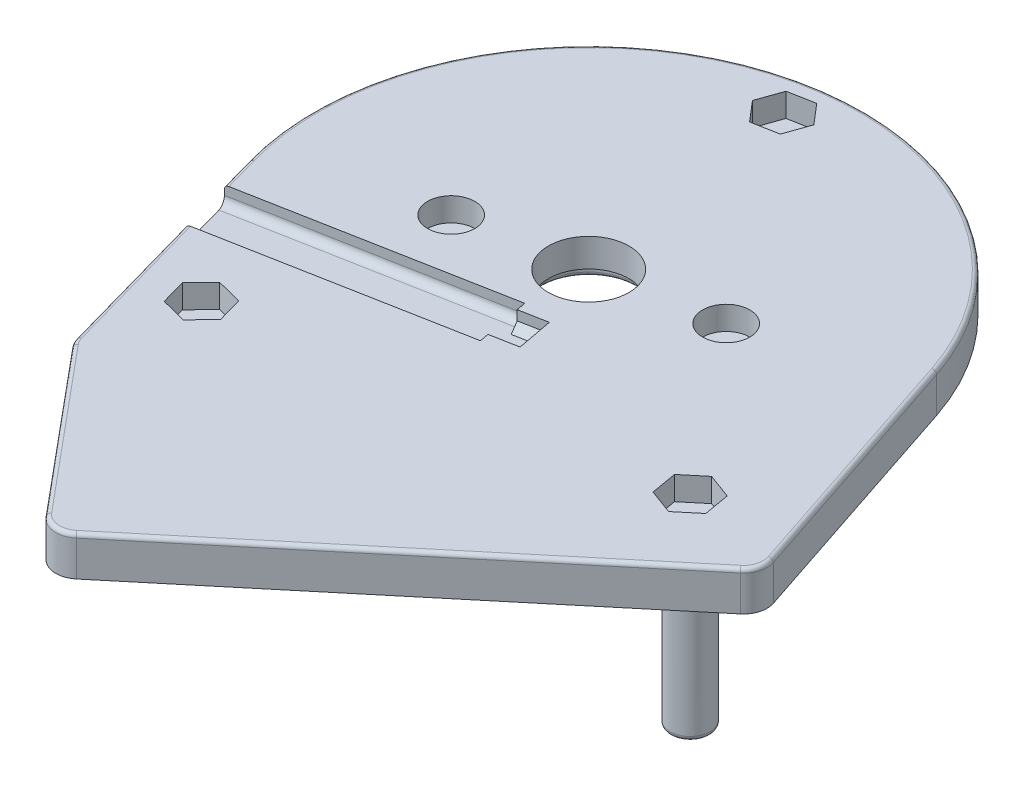
from build123d import *

# Parameters (mm, degrees)
SKETCH1_R           = 3
SKETCH1_R_2         = 5.925
SKETCH1_R_3         = 1.6
SKETCH1_R_4         = 5.125
SKETCH1_R_5         = 2.55
SKETCH1_R_6         = 1.75
BOSS_EXTRUDE7_DEPTH = 5
CUT_EXTRUDE5_START  = 2
SKETCH1_10_R        = 3
SKETCH1_10_R_2      = 1.6
SKETCH1_10_R_3      = 2.55
SKETCH1_10_R_4      = 1.75
CUT_EXTRUDE5_DEPTH  = 3
BOSS_EXTRUDE8_START = 1.8
SKETCH1_11_R        = 1.6
BOSS_EXTRUDE8_DEPTH = 0.2
SKETCH1_12_R        = 5.925
SKETCH1_12_R_2      = 5.125
CUT_EXTRUDE6_DEPTH  = 1.4
SKETCH1_13_R        = 2.55
SKETCH1_13_R_2      = 1.75
BOSS_EXTRUDE9_DEPTH = 20.5
FILLET2_R           = 0.6
FILLET3_R           = 0.5
CUT_EXTRUDE8_DEPTH  = 1.75
CUT_EXTRUDE11_START = -1.75
CUT_EXTRUDE11_DEPTH = 81.470079501
FILLET4_R           = 1
CUT_EXTRUDE12_START = -0.2
CUT_EXTRUDE12_DEPTH = 0.8
FILLET5_R           = 0.5
FILLET6_SIZE        = 1.5
FILLET6_SIZE_2      = 3


with BuildPart() as part:
    # Sketch1 → Boss-Extrude7 (new body)
    # profile 1 of 13: a face of its own
    with BuildSketch(Plane(origin=(0, 26, 0), x_dir=(1, 0, 0), z_dir=(0, 1, 0))):
        with BuildLine():
            Line((-24.557589494, -41.040910968), (-7.688083041, -61.295294711))
            ThreePointArc((-7.688083041, -61.295294711), (-5.655310978, -62.362963047), (-3.462968546, -61.680531657))
            Line((-3.462968546, -61.680531657), (42.605822592, -23.310676556))
            ThreePointArc((42.605822592, -23.310676556), (43.570730463, -21.828701805), (43.533219398, -20.060683343))
            Line((43.533219398, -20.060683343), (33.218915104, 11.022870738))
            ThreePointArc((33.218915104, 11.022870738), (-10.245273875, 33.466914456), (-33.696714348, -9.462105586))
            Line((-33.696714348, -9.462105586), (-25.140703574, -39.932009816))
            ThreePointArc((-25.140703574, -39.932009816), (-24.907679574, -40.517239907), (-24.557589494, -41.040910968))
        make_face()
        with Locations((-14.717565499, -2.764758718)):
            Circle(SKETCH1_R, mode=Mode.SUBTRACT)
        Circle(SKETCH1_R_2, mode=Mode.SUBTRACT)
        with Locations((14.717565499, 2.764758718)):
            Circle(SKETCH1_R, mode=Mode.SUBTRACT)
        Polygon((-20.200894533, -31.346594202), (-17.861525421, -28.950621437), (-18.766814147, -25.726681974), (-22.011471984, -24.898715278), (-24.350841096, -27.294688043), (-23.44555237, -30.518627505), align=None, mode=Mode.SUBTRACT)
        Polygon((28.622795709, -20.44054474), (31.76526722, -21.597353341), (34.338328611, -19.454297482), (33.768918491, -16.154433023), (30.62644698, -14.997624422), (28.05338559, -17.140680281), align=None, mode=Mode.SUBTRACT)
        Polygon((-3.765850495, 32.760363126), (-7.056915893, 32.142122171), (-8.167036219, 28.982855453), (-5.986091147, 26.44182969), (-2.695025749, 27.060070645), (-1.584905423, 30.219337363), align=None, mode=Mode.SUBTRACT)
    # profile 2 of 13: a face of its own
    with BuildSketch(Plane(origin=(0, 26, 0), x_dir=(1, 0, 0), z_dir=(0, 1, 0))):
        with Locations((-14.717565499, -2.764758718)):
            Circle(SKETCH1_R)
        with Locations(Location((-14.717565499, -2.764758718, 0), (0, 0, 270))):
            Circle(SKETCH1_R_3, mode=Mode.SUBTRACT)
    # profile 3 of 13: a face of its own
    with BuildSketch(Plane(origin=(0, 26, 0), x_dir=(1, 0, 0), z_dir=(0, 1, 0))):
        with Locations((14.717565499, 2.764758718)):
            Circle(SKETCH1_R)
        with Locations(Location((14.717565499, 2.764758718, 0), (0, 0, 270))):
            Circle(SKETCH1_R_3, mode=Mode.SUBTRACT)
    # profile 4 of 13: a face of its own
    with BuildSketch(Plane(origin=(0, 26, 0), x_dir=(1, 0, 0), z_dir=(0, 1, 0))):
        Circle(SKETCH1_R_2)
        with Locations(Location((0, 0, 0), (0, 0, 270))):
            Circle(SKETCH1_R_4, mode=Mode.SUBTRACT)
    # profile 5 of 13: a face of its own
    with BuildSketch(Plane(origin=(0, 26, 0), x_dir=(1, 0, 0), z_dir=(0, 1, 0))):
        Polygon((-23.44555237, -30.518627505), (-20.200894533, -31.346594202), (-17.861525421, -28.950621437), (-18.766814147, -25.726681974), (-22.011471984, -24.898715278), (-24.350841096, -27.294688043), align=None)
        with Locations((-21.106183258, -28.12265474)):
            Circle(SKETCH1_R_5, mode=Mode.SUBTRACT)
    # profile 6 of 13: a face of its own
    with BuildSketch(Plane(origin=(0, 26, 0), x_dir=(1, 0, 0), z_dir=(0, 1, 0))):
        with Locations((-21.106183258, -28.12265474)):
            Circle(SKETCH1_R_5)
        with Locations((-21.106183258, -28.12265474)):
            Circle(SKETCH1_R_6, mode=Mode.SUBTRACT)
    # profile 7 of 13: a face of its own
    with BuildSketch(Plane(origin=(0, 26, 0), x_dir=(1, 0, 0), z_dir=(0, 1, 0))):
        with Locations((-21.106183258, -28.12265474)):
            Circle(SKETCH1_R_6)
        with Locations(Location((-21.106183258, -28.12265474, 0), (0, 0, 270))):
            Circle(SKETCH1_R_3, mode=Mode.SUBTRACT)
    # profile 8 of 13: a face of its own
    with BuildSketch(Plane(origin=(0, 26, 0), x_dir=(1, 0, 0), z_dir=(0, 1, 0))):
        Polygon((28.05338559, -17.140680281), (28.622795709, -20.44054474), (31.76526722, -21.597353341), (34.338328611, -19.454297482), (33.768918491, -16.154433023), (30.62644698, -14.997624422), align=None)
        with Locations((31.1958571, -18.297488882)):
            Circle(SKETCH1_R_5, mode=Mode.SUBTRACT)
    # profile 9 of 13: a face of its own
    with BuildSketch(Plane(origin=(0, 26, 0), x_dir=(1, 0, 0), z_dir=(0, 1, 0))):
        with Locations((31.1958571, -18.297488882)):
            Circle(SKETCH1_R_5)
        with Locations((31.1958571, -18.297488882)):
            Circle(SKETCH1_R_6, mode=Mode.SUBTRACT)
    # profile 10 of 13: a face of its own
    with BuildSketch(Plane(origin=(0, 26, 0), x_dir=(1, 0, 0), z_dir=(0, 1, 0))):
        with Locations((31.1958571, -18.297488882)):
            Circle(SKETCH1_R_6)
        with Locations(Location((31.1958571, -18.297488882, 0), (0, 0, 270))):
            Circle(SKETCH1_R_3, mode=Mode.SUBTRACT)
    # profile 11 of 13: a face of its own
    with BuildSketch(Plane(origin=(0, 26, 0), x_dir=(1, 0, 0), z_dir=(0, 1, 0))):
        Polygon((-1.584905423, 30.219337363), (-3.765850495, 32.760363126), (-7.056915893, 32.142122171), (-8.167036219, 28.982855453), (-5.986091147, 26.44182969), (-2.695025749, 27.060070645), align=None)
        with Locations((-4.875970821, 29.601096408)):
            Circle(SKETCH1_R_5, mode=Mode.SUBTRACT)
    # profile 12 of 13: a face of its own
    with BuildSketch(Plane(origin=(0, 26, 0), x_dir=(1, 0, 0), z_dir=(0, 1, 0))):
        with Locations((-4.875970821, 29.601096408)):
            Circle(SKETCH1_R_5)
        with Locations((-4.875970821, 29.601096408)):
            Circle(SKETCH1_R_6, mode=Mode.SUBTRACT)
    # profile 13 of 13: a face of its own
    with BuildSketch(Plane(origin=(0, 26, 0), x_dir=(1, 0, 0), z_dir=(0, 1, 0))):
        with Locations((-4.875970821, 29.601096408)):
            Circle(SKETCH1_R_6)
        with Locations(Location((-4.875970821, 29.601096408, 0), (0, 0, 270))):
            Circle(SKETCH1_R_3, mode=Mode.SUBTRACT)
    extrude(amount=BOSS_EXTRUDE7_DEPTH)

    # Sketch1<10> → Cut-Extrude5 (cut)
    # profile 1 of 11: a face of its own
    with BuildSketch(Plane(origin=(0, 26, 0), x_dir=(1, 0, 0), z_dir=(0, 1, 0)).offset(CUT_EXTRUDE5_START)):
        with Locations(Location((-14.717565499, -2.764758718, 0), (0, 0, 270))):
            Circle(SKETCH1_10_R)
        with Locations(Location((-14.717565499, -2.764758718, 0), (0, 0, 270))):
            Circle(SKETCH1_10_R_2, mode=Mode.SUBTRACT)
    # profile 2 of 11: a face of its own
    with BuildSketch(Plane(origin=(0, 26, 0), x_dir=(1, 0, 0), z_dir=(0, 1, 0)).offset(CUT_EXTRUDE5_START)):
        with Locations(Location((14.717565499, 2.764758718, 0), (0, 0, 270))):
            Circle(SKETCH1_10_R)
        with Locations(Location((14.717565499, 2.764758718, 0), (0, 0, 270))):
            Circle(SKETCH1_10_R_2, mode=Mode.SUBTRACT)
    # profile 3 of 11: a face of its own
    with BuildSketch(Plane(origin=(0, 26, 0), x_dir=(1, 0, 0), z_dir=(0, 1, 0)).offset(CUT_EXTRUDE5_START)):
        Polygon((28.05338559, -17.140680281), (28.622795709, -20.44054474), (31.76526722, -21.597353341), (34.338328611, -19.454297482), (33.768918491, -16.154433023), (30.62644698, -14.997624422), align=None)
        with Locations((31.1958571, -18.297488882)):
            Circle(SKETCH1_10_R_3, mode=Mode.SUBTRACT)
    # profile 4 of 11: a face of its own
    with BuildSketch(Plane(origin=(0, 26, 0), x_dir=(1, 0, 0), z_dir=(0, 1, 0)).offset(CUT_EXTRUDE5_START)):
        with Locations((31.1958571, -18.297488882)):
            Circle(SKETCH1_10_R_3)
        with Locations((31.1958571, -18.297488882)):
            Circle(SKETCH1_10_R_4, mode=Mode.SUBTRACT)
    # profile 5 of 11: a face of its own
    with BuildSketch(Plane(origin=(0, 26, 0), x_dir=(1, 0, 0), z_dir=(0, 1, 0)).offset(CUT_EXTRUDE5_START)):
        with Locations((31.1958571, -18.297488882)):
            Circle(SKETCH1_10_R_4)
        with Locations(Location((31.1958571, -18.297488882, 0), (0, 0, 270))):
            Circle(SKETCH1_10_R_2, mode=Mode.SUBTRACT)
    # profile 6 of 11: a face of its own
    with BuildSketch(Plane(origin=(0, 26, 0), x_dir=(1, 0, 0), z_dir=(0, 1, 0)).offset(CUT_EXTRUDE5_START)):
        Polygon((-23.44555237, -30.518627505), (-20.200894533, -31.346594202), (-17.861525421, -28.950621437), (-18.766814147, -25.726681974), (-22.011471984, -24.898715278), (-24.350841096, -27.294688043), align=None)
        with Locations((-21.106183258, -28.12265474)):
            Circle(SKETCH1_10_R_3, mode=Mode.SUBTRACT)
    # profile 7 of 11: a face of its own
    with BuildSketch(Plane(origin=(0, 26, 0), x_dir=(1, 0, 0), z_dir=(0, 1, 0)).offset(CUT_EXTRUDE5_START)):
        with Locations((-21.106183258, -28.12265474)):
            Circle(SKETCH1_10_R_3)
        with Locations((-21.106183258, -28.12265474)):
            Circle(SKETCH1_10_R_4, mode=Mode.SUBTRACT)
    # profile 8 of 11: a face of its own
    with BuildSketch(Plane(origin=(0, 26, 0), x_dir=(1, 0, 0), z_dir=(0, 1, 0)).offset(CUT_EXTRUDE5_START)):
        with Locations((-21.106183258, -28.12265474)):
            Circle(SKETCH1_10_R_4)
        with Locations(Location((-21.106183258, -28.12265474, 0), (0, 0, 270))):
            Circle(SKETCH1_10_R_2, mode=Mode.SUBTRACT)
    # profile 9 of 11: a face of its own
    with BuildSketch(Plane(origin=(0, 26, 0), x_dir=(1, 0, 0), z_dir=(0, 1, 0)).offset(CUT_EXTRUDE5_START)):
        Polygon((-1.584905423, 30.219337363), (-3.765850495, 32.760363126), (-7.056915893, 32.142122171), (-8.167036219, 28.982855453), (-5.986091147, 26.44182969), (-2.695025749, 27.060070645), align=None)
        with Locations((-4.875970821, 29.601096408)):
            Circle(SKETCH1_10_R_3, mode=Mode.SUBTRACT)
    # profile 10 of 11: a face of its own
    with BuildSketch(Plane(origin=(0, 26, 0), x_dir=(1, 0, 0), z_dir=(0, 1, 0)).offset(CUT_EXTRUDE5_START)):
        with Locations((-4.875970821, 29.601096408)):
            Circle(SKETCH1_10_R_3)
        with Locations((-4.875970821, 29.601096408)):
            Circle(SKETCH1_10_R_4, mode=Mode.SUBTRACT)
    # profile 11 of 11: a face of its own
    with BuildSketch(Plane(origin=(0, 26, 0), x_dir=(1, 0, 0), z_dir=(0, 1, 0)).offset(CUT_EXTRUDE5_START)):
        with Locations((-4.875970821, 29.601096408)):
            Circle(SKETCH1_10_R_4)
        with Locations(Location((-4.875970821, 29.601096408, 0), (0, 0, 270))):
            Circle(SKETCH1_10_R_2, mode=Mode.SUBTRACT)
    extrude(amount=CUT_EXTRUDE5_DEPTH, mode=Mode.SUBTRACT)

    # Sketch1<11> → Boss-Extrude8 (add)
    with BuildSketch(Plane(origin=(0, 26, 0), x_dir=(1, 0, 0), z_dir=(0, 1, 0)).offset(BOSS_EXTRUDE8_START)):
        with Locations(Location((31.1958571, -18.297488882, 0), (0, 0, 270))):
            Circle(SKETCH1_11_R)
        with Locations(Location((-21.106183258, -28.12265474, 0), (0, 0, 270))):
            Circle(SKETCH1_11_R)
        with Locations(Location((-14.717565499, -2.764758718, 0), (0, 0, 270))):
            Circle(SKETCH1_11_R)
        with Locations(Location((14.717565499, 2.764758718, 0), (0, 0, 270))):
            Circle(SKETCH1_11_R)
        with Locations(Location((-4.875970821, 29.601096408, 0), (0, 0, 270))):
            Circle(SKETCH1_11_R)
    extrude(amount=BOSS_EXTRUDE8_DEPTH)

    # Sketch1<12> → Cut-Extrude6 (cut)
    with BuildSketch(Plane(origin=(0, 26, 0), x_dir=(1, 0, 0), z_dir=(0, 1, 0))):
        with Locations(Location((0, 0, 0), (0, 0, 270))):
            Circle(SKETCH1_12_R)
        with Locations(Location((0, 0, 0), (0, 0, 270))):
            Circle(SKETCH1_12_R_2, mode=Mode.SUBTRACT)
    extrude(amount=CUT_EXTRUDE6_DEPTH, mode=Mode.SUBTRACT)

    # Sketch1<13> → Boss-Extrude9 (add)
    # profile 1 of 3: a face of its own
    with BuildSketch(Plane(origin=(0, 26, 0), x_dir=(1, 0, 0), z_dir=(0, 1, 0))):
        with Locations(Location((31.1958571, -18.297488882, 0), (0, 0, 270))):
            Circle(SKETCH1_13_R)
        with Locations(Location((31.1958571, -18.297488882, 0), (0, 0, 270))):
            Circle(SKETCH1_13_R_2, mode=Mode.SUBTRACT)
    # profile 2 of 3: a face of its own
    with BuildSketch(Plane(origin=(0, 26, 0), x_dir=(1, 0, 0), z_dir=(0, 1, 0))):
        with Locations(Location((-21.106183258, -28.12265474, 0), (0, 0, 270))):
            Circle(SKETCH1_13_R)
        with Locations(Location((-21.106183258, -28.12265474, 0), (0, 0, 270))):
            Circle(SKETCH1_13_R_2, mode=Mode.SUBTRACT)
    # profile 3 of 3: a face of its own
    with BuildSketch(Plane(origin=(0, 26, 0), x_dir=(1, 0, 0), z_dir=(0, 1, 0))):
        with Locations(Location((-4.875970821, 29.601096408, 0), (0, 0, 270))):
            Circle(SKETCH1_13_R)
        with Locations(Location((-4.875970821, 29.601096408, 0), (0, 0, 270))):
            Circle(SKETCH1_13_R_2, mode=Mode.SUBTRACT)
    extrude(amount=-BOSS_EXTRUDE9_DEPTH)

    # Fillet2
    fillet2_edges = [part.edges().sort_by_distance(p)[0] for p in [
        (31.1958571, 5.5, 15.747488882),
        (-21.106183258, 5.5, 25.57265474),
        (-4.875970821, 5.5, -31.351096408),
    ]]
    fillet(fillet2_edges, radius=FILLET2_R)

    # Fillet3
    fillet3_edges = [part.edges().sort_by_distance(p)[0] for p in [
        (0, 26, -5.925),
    ]]
    fillet(fillet3_edges, radius=FILLET3_R)

    # Sketch4 → Cut-Extrude8 (cut, symmetric)
    # profile 1 of 2: a face of its own
    with BuildSketch(Plane(origin=(0, 0, 0), x_dir=(-0.18462495614104718, 0, -0.9828090483760904), z_dir=(0.9828090483760904, 0, -0.18462495614104718))):
        Polygon((-13.485, 29.763447588), (-13.485, 31), (-8.825, 31), (-8.825, 29.763447588), (-9.783011998, 28.83), (-12.526988002, 28.83), align=None)
        Polygon((-9.905, 29.13), (-9.125, 29.89), (-9.125, 30.7), (-13.185, 30.7), (-13.185, 29.89), (-12.405, 29.13), align=None, mode=Mode.SUBTRACT)
    # profile 2 of 2: a face of its own
    with BuildSketch(Plane(origin=(0, 0, 0), x_dir=(-0.18462495614104718, 0, -0.9828090483760904), z_dir=(0.9828090483760904, 0, -0.18462495614104718))):
        Polygon((-12.405, 29.13), (-9.905, 29.13), (-9.125, 29.89), (-9.125, 30.7), (-13.185, 30.7), (-13.185, 29.89), align=None)
    extrude(amount=CUT_EXTRUDE8_DEPTH, both=True, mode=Mode.SUBTRACT)

    # Sketch4<5> → Cut-Extrude11 (cut, through all)
    # profile 1 of 4: a face of its own
    with BuildSketch(Plane(origin=(0, 0, 0), x_dir=(-0.18462495614104718, 0, -0.9828090483760904), z_dir=(0.9828090483760904, 0, -0.18462495614104718)).offset(CUT_EXTRUDE11_START)):
        Polygon((-13.485, 29.763447588), (-13.485, 31), (-8.825, 31), (-8.825, 29.763447588), (-9.783011998, 28.83), (-12.526988002, 28.83), align=None)
        Polygon((-9.905, 29.13), (-9.125, 29.89), (-9.125, 30.7), (-13.185, 30.7), (-13.185, 29.89), (-12.405, 29.13), align=None, mode=Mode.SUBTRACT)
    # profile 2 of 4: a face of its own
    with BuildSketch(Plane(origin=(0, 0, 0), x_dir=(-0.18462495614104718, 0, -0.9828090483760904), z_dir=(0.9828090483760904, 0, -0.18462495614104718)).offset(CUT_EXTRUDE11_START)):
        Polygon((-12.405, 29.13), (-9.905, 29.13), (-9.125, 29.89), (-9.125, 30.7), (-13.185, 30.7), (-13.185, 29.89), align=None)
    # profile 3 of 4: a face of its own
    with BuildSketch(Plane(origin=(0, 0, 0), x_dir=(-0.18462495614104718, 0, -0.9828090483760904), z_dir=(0.9828090483760904, 0, -0.18462495614104718)).offset(CUT_EXTRUDE11_START)):
        Polygon((-13.485, 29.763447588), (-13.485, 31), (-14.685, 31), (-14.685, 28.83), (-12.526988002, 28.83), align=None)
    # profile 4 of 4: a face of its own
    with BuildSketch(Plane(origin=(0, 0, 0), x_dir=(-0.18462495614104718, 0, -0.9828090483760904), z_dir=(0.9828090483760904, 0, -0.18462495614104718)).offset(CUT_EXTRUDE11_START)):
        Polygon((-7.625, 31), (-8.825, 31), (-8.825, 29.763447588), (-9.783011998, 28.83), (-7.625, 28.83), align=None)
    extrude(amount=-CUT_EXTRUDE11_DEPTH, mode=Mode.SUBTRACT)

    # Fillet4
    fillet4_edges = [part.edges().sort_by_distance(p)[0] for p in [
        (-14.777676393, 28.83, 17.717915687),
        (-16.387435758, 28.83, 10.836824942),
    ]]
    fillet(fillet4_edges, radius=FILLET4_R)

    # Sketch6 → Cut-Extrude12 (cut)
    with BuildSketch(Plane(origin=(0, 28.83, 0), x_dir=(1, 0, 0), z_dir=(0, 1, 0)).offset(CUT_EXTRUDE12_START)):
        with BuildLine():
            ThreePointArc((2.719027842, -10.211562358), (1.307818809, -10.303698478), (1.399954929, -11.714907511))
            Line((1.399954929, -11.714907511), (2.719027842, -10.211562358))
        make_face()
        with BuildLine():
            Line((2.719027842, -10.211562358), (1.399954929, -11.714907511))
            ThreePointArc((1.399954929, -11.714907511), (2.472082917, -11.874151082), (3.059491386, -10.963234935))
            ThreePointArc((3.059491386, -10.963234935), (2.970407533, -10.550643403), (2.719027842, -10.211562358))
        make_face()
    extrude(amount=-CUT_EXTRUDE12_DEPTH, mode=Mode.SUBTRACT)

    # Fillet5
    fillet5_edges = [part.edges().sort_by_distance(p)[0] for p in [
        (-16.122836267, 31, 51.16810284),
        (-5.655310978, 31, 62.362963047),
        (19.571427023, 31, 42.495604107),
        (-27.843679003, 31, 30.306098321),
        (43.570730463, 31, 21.828701805),
        (38.376067251, 31, 4.518906303),
        (-10.245273875, 31, -33.466914456),
        (-33.079717661, 31, 11.659371401),
        (-24.907679574, 31, 40.517239907),
    ]]
    fillet(fillet5_edges, radius=FILLET5_R)

    # Fillet6
    # an asymmetric fillet: 3, 1.5 mm, written as the material it adds along each edge
    with BuildSketch(Plane(origin=(31.1958571, 26, 18.297488882), x_dir=(0, 0, 1), z_dir=(-1, 0, 0))) as fillet6_piece_1:
        with BuildLine():
            Bezier((2.55 + FILLET6_SIZE, 0), (2.55, 0), (2.55, -FILLET6_SIZE_2), weights=[1, 0.707106781, 1])
            Line((2.55, -FILLET6_SIZE_2), (2.55, 0))
            Line((2.55, 0), (2.55 + FILLET6_SIZE, 0))
        make_face()
    revolve(axis=Axis((31.1958571, 26, 18.297488882), (0, 1, 0)))
    with BuildSketch(Plane(origin=(-21.106183258, 26, 28.12265474), x_dir=(0, 0, 1), z_dir=(-1, 0, 0))) as fillet6_piece_2:
        with BuildLine():
            Bezier((2.55 + FILLET6_SIZE, 0), (2.55, 0), (2.55, -FILLET6_SIZE_2), weights=[1, 0.707106781, 1])
            Line((2.55, -FILLET6_SIZE_2), (2.55, 0))
            Line((2.55, 0), (2.55 + FILLET6_SIZE, 0))
        make_face()
    revolve(axis=Axis((-21.106183258, 26, 28.12265474), (0, 1, 0)))
    with BuildSketch(Plane(origin=(-4.875970821, 26, -29.601096408), x_dir=(0, 0, 1), z_dir=(-1, 0, 0))) as fillet6_piece_3:
        with BuildLine():
            Bezier((2.55 + FILLET6_SIZE, 0), (2.55, 0), (2.55, -FILLET6_SIZE_2), weights=[1, 0.707106781, 1])
            Line((2.55, -FILLET6_SIZE_2), (2.55, 0))
            Line((2.55, 0), (2.55 + FILLET6_SIZE, 0))
        make_face()
    revolve(axis=Axis((-4.875970821, 26, -29.601096408), (0, 1, 0)))


solid = part.part
